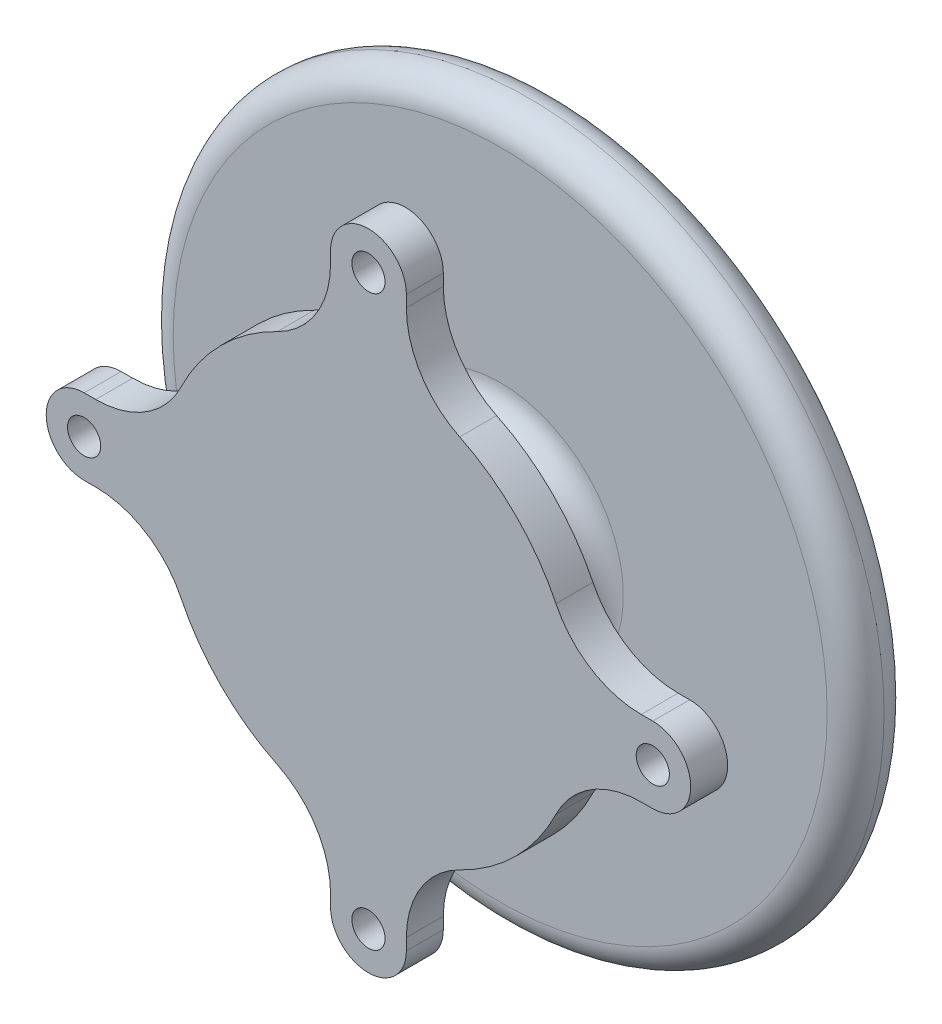
from build123d import *

# Parameters (mm, degrees)
SKETCH2_R           = 15
SKETCH1_R           = 25
SKETCH3_R           = 15
BOSS_EXTRUDE1_DEPTH = 5
FILLET1_R           = 10
SKETCH4_R           = 1.75
CUT_EXTRUDE1_DEPTH  = 130
SKETCH5_R           = 4
CUT_EXTRUDE2_DEPTH  = 130
SKETCH6_R           = 22
BOSS_EXTRUDE2_DEPTH = 4
SKETCH7_R           = 17
BOSS_EXTRUDE3_DEPTH = 20
SKETCH15_W          = 8.431609766
SKETCH15_H          = 4
SKETCH15_W_2        = 8.578672696
SKETCH18_R          = 12.5
CUT_EXTRUDE5_DEPTH  = 20
SKETCH19_R          = 47.987160243
CUT_EXTRUDE6_DEPTH  = 44.301270362
SKETCH20_R          = 1.75
BOSS_EXTRUDE5_DEPTH = 4
CIRPATTERN3_COUNT   = 4
FILLET2_R           = 10
CHAMFER1_SIZE       = 0.5
SKETCH22_W          = 15
SKETCH22_H          = 8
BOSS_EXTRUDE6_DEPTH = 7.5
CUT_EXTRUDE7_DEPTH  = 0.75
CHAMFER2_SIZE       = 3
CHAMFER3_SIZE       = 0.5
CUT_EXTRUDE8_START  = -0.1
SKETCH24_R          = 41.017326151
SKETCH24_R_2        = 17
CUT_EXTRUDE8_DEPTH  = 0.1
SKETCH26_W          = 86.249785383
SKETCH26_H          = 35.556355766
CUT_EXTRUDE9_DEPTH  = 50
SKETCH27_R          = 10
BOSS_EXTRUDE7_DEPTH = 10
SKETCH28_R          = 37.5
BOSS_EXTRUDE8_DEPTH = 6
FILLET3_R           = 3


with BuildPart() as part:
    # Sketch2 → Loft1 section 0
    with BuildSketch(Plane.XY.offset(20)):
        Circle(SKETCH2_R)
    # Sketch1 → Loft1 section 1
    with BuildSketch(Plane.XY):
        Circle(SKETCH1_R)
    loft()

    # Sketch3 → Boss-Extrude1 (add)
    with BuildSketch(Plane.XY.offset(20)):
        Circle(SKETCH3_R)
    extrude(amount=BOSS_EXTRUDE1_DEPTH)

    # Fillet1
    fillet1_edges = [part.edges().sort_by_distance(p)[0] for p in [
        (-15, 0, 20),
    ]]
    fillet(fillet1_edges, radius=FILLET1_R)

    # Sketch4 → Cut-Extrude1 (cut)
    with BuildSketch(Plane(origin=(0, 0, 0), x_dir=(-1, 0, 0), z_dir=(0, 0, -1))):
        with Locations((0, 20)):
            Circle(SKETCH4_R)
        with Locations((-20, 0)):
            Circle(SKETCH4_R)
        with Locations((0, -20)):
            Circle(SKETCH4_R)
        with Locations((20, 0)):
            Circle(SKETCH4_R)
    extrude(amount=-CUT_EXTRUDE1_DEPTH, mode=Mode.SUBTRACT)

    # Sketch5 → Cut-Extrude2 (cut)
    with BuildSketch(Plane(origin=(0, 0, 3), x_dir=(-1, 0, 0), z_dir=(0, 0, -1))):
        with Locations((0, 20)):
            Circle(SKETCH5_R)
        with Locations((20, 0)):
            Circle(SKETCH5_R)
        with Locations((-20, 0)):
            Circle(SKETCH5_R)
        with Locations((0, -20)):
            Circle(SKETCH5_R)
    extrude(amount=-CUT_EXTRUDE2_DEPTH, mode=Mode.SUBTRACT)

    # Sketch6 → Boss-Extrude2 (add)
    with BuildSketch(Plane.XY.offset(25)):
        Circle(SKETCH6_R)
    extrude(amount=BOSS_EXTRUDE2_DEPTH)

    # Sketch7 → Boss-Extrude3 (add)
    with BuildSketch(Plane.XY.offset(29)):
        Circle(SKETCH7_R)
    extrude(amount=BOSS_EXTRUDE3_DEPTH)

    # Sketch15 → Cut-Revolve1 (revolve, cut)
    with BuildSketch(Plane(origin=(0, 0, 0), x_dir=(1, 0, 0), z_dir=(0, 1, 0))):
        with Locations((-17.215804883, -35)):
            Rectangle(SKETCH15_W, SKETCH15_H)
        with Locations((-17.289336348, -43)):
            Rectangle(SKETCH15_W_2, SKETCH15_H)
    revolve(axis=Axis((0, 0, 29), (0, 0, 1)), mode=Mode.SUBTRACT)

    # Sketch18 → Cut-Extrude5 (cut)
    with BuildSketch(Plane(origin=(0, 0, 0), x_dir=(-1, 0, 0), z_dir=(0, 0, -1))):
        Circle(SKETCH18_R)
    extrude(amount=-CUT_EXTRUDE5_DEPTH, mode=Mode.SUBTRACT)

    # Sketch19 → Cut-Extrude6 (cut, through all)
    with BuildSketch(Plane(origin=(0, 0, 25), x_dir=(-1, 0, 0), z_dir=(0, 0, -1))):
        Circle(SKETCH19_R)
    extrude(amount=CUT_EXTRUDE6_DEPTH, mode=Mode.SUBTRACT)

    # Sketch20 → Boss-Extrude5 (add)
    with BuildSketch(Plane(origin=(0, 0, 25), x_dir=(-1, 0, 0), z_dir=(0, 0, -1))):
        with BuildLine():
            Line((-4, 30), (-4, 21.633307653))
            ThreePointArc((-4, 21.633307653), (0, 22), (4, 21.633307653))
            Line((4, 21.633307653), (4, 30))
            ThreePointArc((4, 30), (0, 34), (-4, 30))
        make_face()
        with Locations((0, 30)):
            Circle(SKETCH20_R, mode=Mode.SUBTRACT)
    boss_extrude5 = extrude(amount=-BOSS_EXTRUDE5_DEPTH)

    # CirPattern3: Boss-Extrude5 ×4 about axis
    cirpattern3_axis = Axis((0, 0, 0), (0, 0, 1))
    for i in range(1, CIRPATTERN3_COUNT):
        add(boss_extrude5.rotate(cirpattern3_axis, i * 360 / CIRPATTERN3_COUNT))

    # Fillet2
    fillet2_edges = [part.edges().sort_by_distance(p)[0] for p in [
        (-4, 21.633307653, 27),
        (4, 21.633307653, 27),
        (-21.633307653, -4, 27),
        (-21.633307653, 4, 27),
        (4, -21.633307653, 27),
        (-4, -21.633307653, 27),
        (21.633307653, 4, 27),
        (21.633307653, -4, 27),
    ]]
    fillet(fillet2_edges, radius=FILLET2_R)

    # Chamfer1
    chamfer1_edges = [part.edges().sort_by_distance(p)[0] for p in [
        (-17, 0, 49),
        (-17, 0, 37),
        (-17, 0, 33),
        (-17, 0, 45),
        (-17, 0, 41),
    ]]
    chamfer(chamfer1_edges, length=CHAMFER1_SIZE)

    # Sketch22 → Boss-Extrude6 (add, symmetric)
    with BuildSketch(Plane(origin=(0, 0, 0), x_dir=(1, 0, 0), z_dir=(0, 1, 0))):
        with Locations((0, -53)):
            Rectangle(SKETCH22_W, SKETCH22_H)
    extrude(amount=BOSS_EXTRUDE6_DEPTH, both=True)

    # Sketch23 → Cut-Extrude7 (cut, symmetric)
    with BuildSketch(Plane(origin=(0, 0, 0), x_dir=(1, 0, 0), z_dir=(0, 1, 0))):
        with BuildLine():
            Line((7.5, -53.009618943), (7.5, -49))
            Line((7.5, -49), (-7.5, -49))
            Line((-7.5, -49), (-7.5, -53.009618943))
            ThreePointArc((-7.5, -53.009618943), (0, -51), (7.5, -53.009618943))
        make_face()
    extrude(amount=CUT_EXTRUDE7_DEPTH, both=True, mode=Mode.SUBTRACT)

    # Chamfer2
    chamfer2_edges = [part.edges().sort_by_distance(p)[0] for p in [
        (7.5, -7.5, 53),
        (-7.5, -7.5, 53),
        (7.5, 7.5, 53),
        (-7.5, 7.5, 53),
    ]]
    chamfer(chamfer2_edges, length=CHAMFER2_SIZE)

    # Chamfer3
    chamfer3_edges = [part.edges().sort_by_distance(p)[0] for p in [
        (-7.5, -2.625, 49),
        (7.5, -2.625, 49),
        (7.5, 2.625, 49),
        (7.5, 0, 57),
        (0, -7.5, 57),
        (0, -7.5, 49),
        (0, 7.5, 57),
        (-7.5, 0, 57),
        (-6, 6, 57),
        (-6, -6, 57),
        (6, 6, 57),
        (6, -6, 57),
        (0, 7.5, 49),
        (-7.5, 2.625, 49),
        (6, -6, 49),
        (6, 6, 49),
        (-6, -6, 49),
        (-6, 6, 49),
    ]]
    chamfer(chamfer3_edges, length=CHAMFER3_SIZE)

    # Sketch24 → Cut-Extrude8 (cut)
    with BuildSketch(Plane.XY.offset(29).offset(CUT_EXTRUDE8_START)):
        Circle(SKETCH24_R)
        with Locations(Location((0, 0, 0), (0, 0, 180))):
            Circle(SKETCH24_R_2, mode=Mode.SUBTRACT)
    extrude(amount=CUT_EXTRUDE8_DEPTH, mode=Mode.SUBTRACT)

    # Sketch26 → Cut-Extrude9 (cut, symmetric)
    with BuildSketch(Plane(origin=(0, 0, 0), x_dir=(1, 0, 0), z_dir=(0, 1, 0))):
        with Locations((1.892134232, -46.678177883)):
            Rectangle(SKETCH26_W, SKETCH26_H)
    extrude(amount=CUT_EXTRUDE9_DEPTH, both=True, mode=Mode.SUBTRACT)

    # Sketch27 → Boss-Extrude7 (add)
    with BuildSketch(Plane(origin=(0, 0, 25), x_dir=(-1, 0, 0), z_dir=(0, 0, -1))):
        Circle(SKETCH27_R)
    extrude(amount=BOSS_EXTRUDE7_DEPTH)

    # Sketch28 → Boss-Extrude8 (add)
    with BuildSketch(Plane(origin=(0, 0, 15), x_dir=(-1, 0, 0), z_dir=(0, 0, -1))):
        Circle(SKETCH28_R)
    extrude(amount=BOSS_EXTRUDE8_DEPTH)

    # Fillet3
    fillet3_edges = [part.edges().sort_by_distance(p)[0] for p in [
        (10, 0, 25),
        (10, 0, 15),
        (37.5, 0, 15),
        (37.5, 0, 9),
    ]]
    fillet(fillet3_edges, radius=FILLET3_R - 0.0001)  # a hair under: the kernel refuses the full size


solid = part.part
